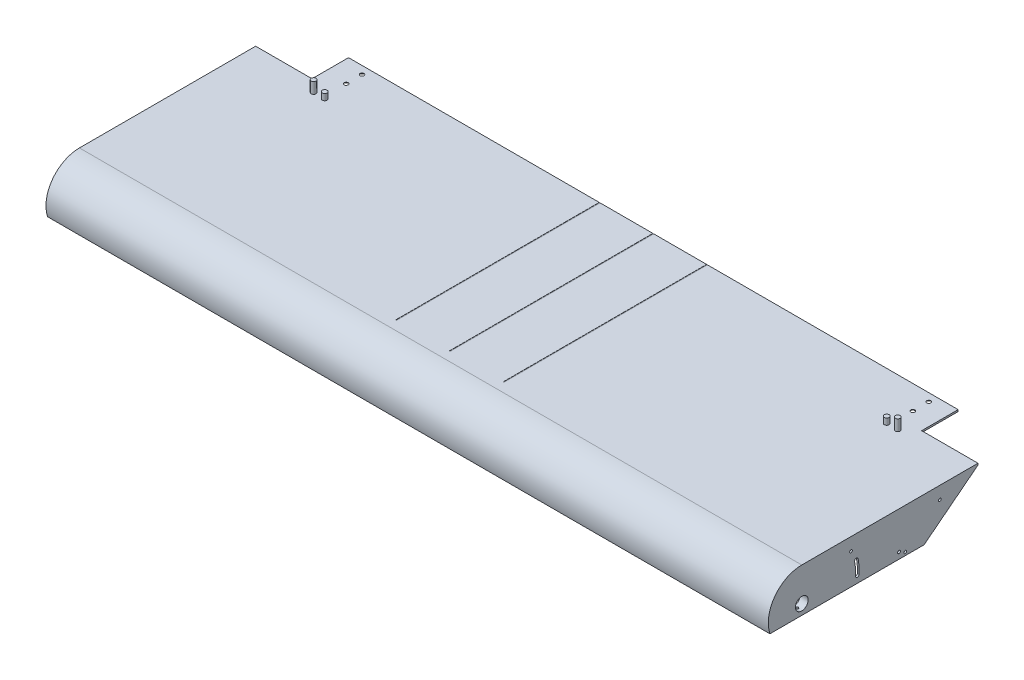
from build123d import *

# Parameters (mm, degrees)
EXTRUDE1_DEPTH                                = 722.3125
SHELL1_T                                      = -3.429
SKETCH19_W                                    = 1437.767
SKETCH19_H                                    = 25.4
CUT_EXTRUDE2_DEPTH                            = 2.54
ARC_SLOT_DEPTH                                = 1489.497316857
SKETCH3_R                                     = 2.7686
EXTRUDE3_DEPTH                                = 723.9
SKETCH5_W                                     = 38.1
SKETCH5_H                                     = 40.894
EXTRUDE5_DEPTH                                = 719.2645
SKETCH4_R                                     = 12.7127
EXTRUDE4_DEPTH                                = 723.9
EXTRUDE6_DEPTH                                = 25.4
EXTRUDE6_DEPTH_BACK                           = 40.894
SKETCH6_W                                     = 1412.367
SKETCH6_H                                     = 38.1
F_1_4_28_TAPPED_HOLE1_REACH                   = 810.439
F_1_4_28_TAPPED_HOLE1_BORE_R                  = 2.7051
SQUARE_TUBING_DEPTH                           = 1437.767
SKETCH20_W                                    = 1219.2
SKETCH20_H                                    = 73.025
EXTENSION_DEPTH                               = 3.429
SKETCH22_R                                    = 4.7625
BOSS_EXTRUDE1_DEPTH                           = 12.7
BOSS_EXTRUDE1_2_DEPTH                         = 12.7
SKETCH25_R                                    = 4.7625
BOSS_EXTRUDE2_DEPTH                           = 22.225
CSK_FOR_1_4_FLAT_HEAD_MACHINE_SCREW1_AT_COUNT = 2
CSK_FOR_1_4_FLAT_HEAD_MACHINE_SCREW1_AT_PITCH = 31.75
CSK_FOR_1_4_FLAT_HEAD_MACHINE_SCREW1_2_COUNT  = 2
CSK_FOR_1_4_FLAT_HEAD_MACHINE_SCREW1_2_PITCH  = 1133.919590679
CSK_FOR_1_4_FLAT_HEAD_MACHINE_SCREW1_3_COUNT  = 2
CSK_FOR_1_4_FLAT_HEAD_MACHINE_SCREW1_3_PITCH  = 1133.475
CUT_EXTRUDE3_DEPTH                            = 0.381
F_1_4_28_START                                = 718.8835
F_1_4_28_TAPPED_HOLE2_OUTLINE_R               = 2.7051
F_1_4_28_TAPPED_HOLE2_DEPTH                   = 3.429


# Read off the part's stored shape, not the designer's step: 1/4-28 Tapped Hole2
with BuildPart() as part:
    # Sketch1 → Extrude1 (new, symmetric)
    with BuildSketch(Plane(origin=(0, 0, 0), x_dir=(0, 0, -1), z_dir=(1, 0, 0))):
        with BuildLine():
            Line((0, 66.929), (352.425, 66.929))
            Line((352.425, 66.929), (352.425, 63.754))
            Line((352.425, 63.754), (244.652634628, -20.447))
            Line((244.652634628, -20.447), (-63.729202349, -20.447))
            ThreePointArc((-63.729202349, -20.447), (-54.073969264, 39.439788146), (0, 66.929))
        make_face()
    extrude(amount=EXTRUDE1_DEPTH, both=True)

    # Shell1
    shell1_openings = [part.faces().sort_by_distance(p)[0] for p in [
        (0, -20.447, -90.46171614),
        (0, 21.6535, -298.538817314),
    ]]
    offset(amount=SHELL1_T, openings=shell1_openings, kind=Kind.INTERSECTION)

    # Sketch19 → Cut-Extrude2 (cut)
    with BuildSketch(Plane.XZ.offset(-63.5)):
        with Locations((0, -344.926857936)):
            Rectangle(SKETCH19_W, SKETCH19_H)
    extrude(amount=CUT_EXTRUDE2_DEPTH, mode=Mode.SUBTRACT)

    # Sketch12 → ARC SLOT (cut, through all)
    with BuildSketch(Plane(origin=(722.3125, 0, 0), x_dir=(0, 0, -1), z_dir=(1, 0, 0))):
        with BuildLine():
            ThreePointArc((114.49361262, -6.5532), (114.438573641, 7.452826572), (112.676563863, 21.347686455))
            ThreePointArc((112.676563863, 21.347686455), (108.520773156, 24.179589631), (105.68886998, 20.023798923))
            ThreePointArc((105.68886998, 20.023798923), (107.341607834, 6.990635777), (107.393233543, -6.1468))
            ThreePointArc((107.393233543, -6.1468), (110.740223081, -9.900189539), (114.49361262, -6.5532))
        make_face()
    extrude(amount=-ARC_SLOT_DEPTH, mode=Mode.SUBTRACT)

    # Sketch3 → Extrude3 (cut, symmetric)
    with BuildSketch(Plane(origin=(0, 0, 0), x_dir=(0, 0, -1), z_dir=(1, 0, 0))):
        with Locations(Location((194.360634628, -7.747, 0), (0, 0, 180))):
            Circle(SKETCH3_R)
        with Locations(Location((207.060634628, -14.097, 0), (0, 0, 180))):
            Circle(SKETCH3_R)
    extrude(amount=EXTRUDE3_DEPTH, both=True, mode=Mode.SUBTRACT)

    # Sketch5 → Extrude5 (add, symmetric)
    with BuildSketch(Plane(origin=(0, 0, 0), x_dir=(0, 0, -1), z_dir=(1, 0, 0))):
        Rectangle(SKETCH5_W, SKETCH5_H)
    extrude(amount=EXTRUDE5_DEPTH, both=True)

    # Sketch4 → Extrude4 (cut, symmetric)
    with BuildSketch(Plane(origin=(0, 0, 0), x_dir=(0, 0, -1), z_dir=(1, 0, 0))):
        with Locations(Location((0, 0, 0), (0, 0, 180))):
            Circle(SKETCH4_R)
    extrude(amount=EXTRUDE4_DEPTH, both=True, mode=Mode.SUBTRACT)

    # Sketch6 → Extrude6 (cut, two sides: drawn at the far end of the back side and taken through both)
    with BuildSketch(Plane.XZ.offset(20.447).offset(-EXTRUDE6_DEPTH_BACK)):
        Rectangle(SKETCH6_W, SKETCH6_H)
    extrude(amount=EXTRUDE6_DEPTH + EXTRUDE6_DEPTH_BACK, mode=Mode.SUBTRACT)

    # 1/4-28 Tapped Hole1 bore → 1/4-28 Tapped Hole1 (cut, up to next)
    with BuildSketch(Plane.XZ.offset(20.447), mode=Mode.PRIVATE) as f_1_4_28_tapped_hole1_sk1:
        with Locations((712.5335, 0)):
            Circle(F_1_4_28_TAPPED_HOLE1_BORE_R)
    f_1_4_28_tapped_hole1_tool1 = extrude(f_1_4_28_tapped_hole1_sk1.sketch, amount=-F_1_4_28_TAPPED_HOLE1_REACH, mode=Mode.PRIVATE) & part.part
    # 1/4-28 Tapped Hole1 bore → 1/4-28 Tapped Hole1 (cut, up to next)
    with BuildSketch(Plane.XZ.offset(20.447), mode=Mode.PRIVATE) as f_1_4_28_tapped_hole1_sk2:
        with Locations((-712.5335, 0)):
            Circle(F_1_4_28_TAPPED_HOLE1_BORE_R)
    f_1_4_28_tapped_hole1_tool2 = extrude(f_1_4_28_tapped_hole1_sk2.sketch, amount=-F_1_4_28_TAPPED_HOLE1_REACH, mode=Mode.PRIVATE) & part.part
    add(f_1_4_28_tapped_hole1_tool1.solids().sort_by_distance((712.5335, -20.447, 0))[0], mode=Mode.SUBTRACT)
    add(f_1_4_28_tapped_hole1_tool2.solids().sort_by_distance((-712.5335, -20.447, 0))[0], mode=Mode.SUBTRACT)

    # Sketch18 → SQUARE TUBING (add)
    with BuildSketch(Plane(origin=(-718.8835, 0, 0), x_dir=(0, 0, -1), z_dir=(1, 0, 0))):
        with BuildLine():
            Line((130.175, 63.5), (161.925, 63.5))
            ThreePointArc((161.925, 63.5), (164.17006403, 62.57006403), (165.1, 60.325))
            Line((165.1, 60.325), (165.1, 28.575))
            ThreePointArc((165.1, 28.575), (164.17006403, 26.32993597), (161.925, 25.4))
            Line((161.925, 25.4), (130.175, 25.4))
            ThreePointArc((130.175, 25.4), (127.92993597, 26.32993597), (127, 28.575))
            Line((127, 28.575), (127, 60.325))
            ThreePointArc((127, 60.325), (127.92993597, 62.57006403), (130.175, 63.5))
        make_face()
        with BuildLine():
            Line((133.16839, 58.928), (158.93161, 58.928))
            ThreePointArc((158.93161, 58.928), (160.060428194, 58.460428194), (160.528, 57.33161))
            Line((160.528, 57.33161), (160.528, 31.56839))
            ThreePointArc((160.528, 31.56839), (160.060428194, 30.439571806), (158.93161, 29.972))
            Line((158.93161, 29.972), (133.16839, 29.972))
            ThreePointArc((133.16839, 29.972), (132.039571806, 30.439571806), (131.572, 31.56839))
            Line((131.572, 31.56839), (131.572, 57.33161))
            ThreePointArc((131.572, 57.33161), (132.039571806, 58.460428194), (133.16839, 58.928))
        make_face(mode=Mode.SUBTRACT)
    extrude(amount=SQUARE_TUBING_DEPTH)

    # Sketch20 → EXTENSION (add)
    with BuildSketch(Plane(origin=(0, 66.929, 0), x_dir=(1, 0, 0), z_dir=(0, 1, 0))):
        with Locations((0, 388.9375)):
            Rectangle(SKETCH20_W, SKETCH20_H)
    extrude(amount=-EXTENSION_DEPTH)

    # Sketch25 → Boss-Extrude2 (add)
    with BuildSketch(Plane(origin=(0, 66.929, 0), x_dir=(1, 0, 0), z_dir=(0, 1, 0))):
        with Locations(Location((-584.2, 330.2, 0), (0, 0, 90))):
            Circle(SKETCH25_R)
        with Locations(Location((584.2, 330.2, 0), (0, 0, 90))):
            Circle(SKETCH25_R)
    extrude(amount=BOSS_EXTRUDE2_DEPTH)

    # Sketch26 → CSK for 1/4 Flat Head Machine Screw1 (revolve, cut)
    with BuildSketch(Plane(origin=(-566.7375, 63.5, -409.575), x_dir=(0, 0, -1), z_dir=(1, 0, 0))):
        Polygon((0, 0), (0, 3.43005), (3.57124, 3.43005), (3.57124, 3.806858607), (6.8804917, 0), align=None)
    csk_for_1_4_flat_head_machine_screw1 = revolve(axis=Axis((-566.7375, 57.15, -409.575), (0, 1, 0)), mode=Mode.SUBTRACT)

    # CSK for 1/4 Flat Head Machine Screw1 at: CSK for 1/4 Flat Head Machine Screw1 ×2
    with Locations(*[(0, 0, i * CSK_FOR_1_4_FLAT_HEAD_MACHINE_SCREW1_AT_PITCH) for i in range(1, CSK_FOR_1_4_FLAT_HEAD_MACHINE_SCREW1_AT_COUNT)]):
        add(csk_for_1_4_flat_head_machine_screw1, mode=Mode.SUBTRACT)

    # CSK for 1_4 Flat Head Machine Screw1 2: CSK for 1/4 Flat Head Machine Screw1 ×2
    with Locations(*[Vector(0.9996079169260532, 0, 0.028000221762634604) * (i * CSK_FOR_1_4_FLAT_HEAD_MACHINE_SCREW1_2_PITCH) for i in range(1, CSK_FOR_1_4_FLAT_HEAD_MACHINE_SCREW1_2_COUNT)]):
        add(csk_for_1_4_flat_head_machine_screw1, mode=Mode.SUBTRACT)

    # CSK for 1_4 Flat Head Machine Screw1 3: CSK for 1/4 Flat Head Machine Screw1 ×2
    with Locations(*[(i * CSK_FOR_1_4_FLAT_HEAD_MACHINE_SCREW1_3_PITCH, 0, 0) for i in range(1, CSK_FOR_1_4_FLAT_HEAD_MACHINE_SCREW1_3_COUNT)]):
        add(csk_for_1_4_flat_head_machine_screw1, mode=Mode.SUBTRACT)

    # Sketch28 → Cut-Extrude3 (cut)
    with BuildSketch(Plane(origin=(0, 66.929, 0), x_dir=(1, 0, 0), z_dir=(0, 1, 0))):
        with BuildLine():
            Line((-0.79375, 425.45), (-0.79375, 19.05))
            ThreePointArc((-0.79375, 19.05), (0, 18.25625), (0.79375, 19.05))
            Line((0.79375, 19.05), (0.79375, 425.45))
            Line((0.79375, 425.45), (-0.79375, 425.45))
        make_face()
        with BuildLine():
            Line((106.57205, 425.45), (106.57205, 19.05))
            ThreePointArc((106.57205, 19.05), (107.3658, 18.25625), (108.15955, 19.05))
            Line((108.15955, 19.05), (108.15955, 425.45))
            Line((108.15955, 425.45), (106.57205, 425.45))
        make_face()
        with BuildLine():
            Line((-108.15955, 425.45), (-106.57205, 425.45))
            Line((-106.57205, 425.45), (-106.57205, 19.05))
            ThreePointArc((-106.57205, 19.05), (-107.3658, 18.25625), (-108.15955, 19.05))
            Line((-108.15955, 19.05), (-108.15955, 425.45))
        make_face()
    extrude(amount=-CUT_EXTRUDE3_DEPTH, mode=Mode.SUBTRACT)

    # 1/4-28 Tapped Hole2 outline → 1/4-28 Tapped Hole2 (cut)
    with BuildSketch(Plane.YZ.offset(F_1_4_28_START)):
        with Locations((41.529, -276.225)):
            Circle(F_1_4_28_TAPPED_HOLE2_OUTLINE_R)
        with Locations((41.529, -98.425)):
            Circle(F_1_4_28_TAPPED_HOLE2_OUTLINE_R)
    f_1_4_28_tapped_hole2 = extrude(amount=F_1_4_28_TAPPED_HOLE2_DEPTH, mode=Mode.SUBTRACT)

    # Mirror1: 1/4-28 Tapped Hole2 across plane
    add(f_1_4_28_tapped_hole2.mirror(Plane(origin=(0, 0, 0), x_dir=(0, 0, 1), z_dir=(1, 0, 0))), mode=Mode.SUBTRACT)


with BuildPart() as body_2:
    # Sketch22 → Boss-Extrude1 (new body)
    with BuildSketch(Plane(origin=(0, 66.929, 0), x_dir=(-1, 0, 0), z_dir=(0, 1, 0))):
        with Locations(Location((561.975, -330.2, 0), (0, 0, 90))):
            Circle(SKETCH22_R)
    extrude(amount=BOSS_EXTRUDE1_DEPTH)


with BuildPart() as body_3:
    # Sketch22 → Boss-Extrude1 2 (new body)
    with BuildSketch(Plane(origin=(0, 66.929, 0), x_dir=(-1, 0, 0), z_dir=(0, 1, 0))):
        with Locations(Location((-561.975, -330.2, 0), (0, 0, 90))):
            Circle(SKETCH22_R)
    extrude(amount=BOSS_EXTRUDE1_2_DEPTH)


solid = Compound([part.part, body_2.part, body_3.part])
